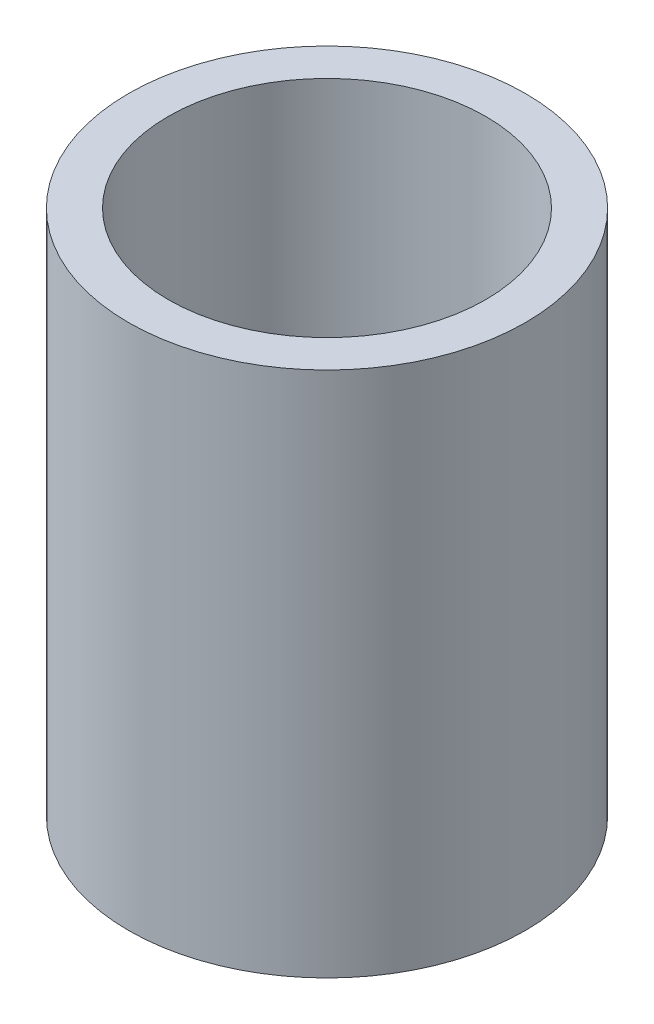
from build123d import *

# Parameters (mm, degrees)
SKETCH1_W = 1.5
SKETCH1_H = 19.9


with BuildPart() as part:
    # Sketch1 → Revolve1 (revolve)
    with BuildSketch(Plane.XY):
        with Locations((6.75, 9.95)):
            Rectangle(SKETCH1_W, SKETCH1_H)
    revolve(axis=Axis((0, 0, 0), (0, 1, 0)))


solid = part.part
